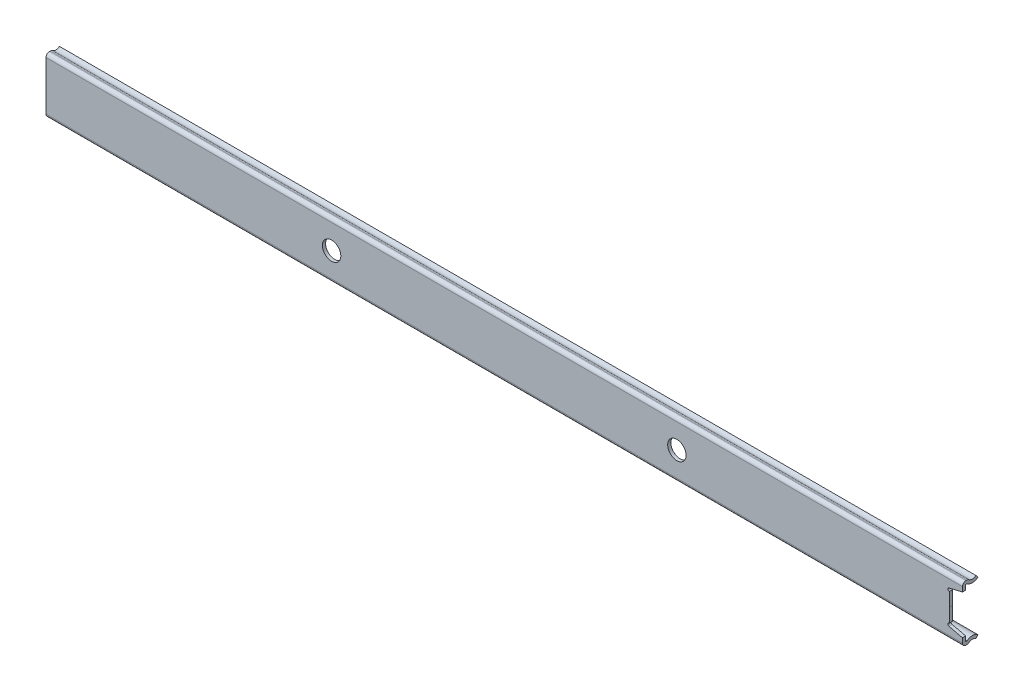
from build123d import *
from build123d.topology import SkipClean

# Parameters (mm, degrees)
EXTRUDE1_DEPTH        = 200.025
MIDDLE_MEMBER_DEPTH   = 400.05
DRAWER_START          = -400.05
DRAWER_MEMBER_DEPTH   = 400.05
SKETCH6_W             = 1.905
SKETCH6_H             = 12.147486483
CUT_EXTRUDE1_DEPTH    = 607.987132866
CUT_EXTRUDE2_DEPTH    = 1.1938
CUT_EXTRUDE3_DEPTH    = 1.397
CUT_EXTRUDE4_DEPTH    = 605.989768868
CUT_EXTRUDE5_DEPTH    = 1.1938
CUT_EXTRUDE14_DEPTH   = 1.1938
CUT_F_DEPTH           = 1.1938
CUT_G_DEPTH           = 1.1938
CUT_EXTRUDE15_DEPTH   = 1.1938
CUT_EXTRUDE17_DEPTH   = 1.2192
LPATTERN1_COUNT       = 6
LPATTERN1_PITCH       = 19.05
EXTRUDE7_DEPTH        = 6.35
EXTRUDE7_DEPTH_BACK   = 101.6
SKETCH28_W            = 7.62
SKETCH28_H            = 0.762
LPATTERN2_COUNT       = 6
LPATTERN2_PITCH       = 19.05
EXTRUDE8_DEPTH        = 6.35
EXTRUDE8_DEPTH_BACK   = 101.6
SKETCH30_W            = 5.08
SKETCH30_H            = 0.762
CROQUIS1_R            = 4
CORTAR_EXTRUIR1_DEPTH = 5


# Read off the part's stored shape, not the designer's step: Drawer Member
with BuildPart() as part:
    # Sketch1 → Extrude1 (new, symmetric)
    with BuildSketch(Plane(origin=(0, 0, 0), x_dir=(0, 0, -1), z_dir=(1, 0, 0))):
        with BuildLine():
            Line((-4.139279899, 22.8203125), (-0.743323143, 22.698920454))
            Line((-0.743323143, 22.698920454), (3.892452069, 22.8203125))
            ThreePointArc((3.892452069, 22.8203125), (5.124499805, 22.338098312), (5.6388, 21.119095664))
            Line((5.6388, 21.119095664), (5.6388, 0))
            Line((5.6388, 0), (4.445, 0))
            Line((4.445, 0), (4.445, 21.119095664))
            ThreePointArc((4.445, 21.119095664), (4.291477554, 21.482977052), (3.92370211, 21.626921585))
            Line((3.92370211, 21.626921585), (0.761857041, 21.544125758))
            ThreePointArc((0.761857041, 21.544125758), (-0.187154328, 21.71413397), (-1.131158407, 21.51822157))
            Line((-1.131158407, 21.51822157), (-4.181926298, 21.627274477))
            ThreePointArc((-4.181926298, 21.627274477), (-4.367367911, 21.55622161), (-4.445, 21.3734366))
            Line((-4.445, 21.3734366), (-4.445, 18.415))
            Line((-4.445, 18.415), (-5.6388, 18.415))
            Line((-5.6388, 18.415), (-5.6388, 21.3734366))
            ThreePointArc((-5.6388, 21.3734366), (-5.19629709, 22.415311161), (-4.139279899, 22.8203125))
        make_face()
    extrude(amount=EXTRUDE1_DEPTH, both=True)

    # Sketch8 → Cut-Extrude2 (cut)
    with BuildSketch(Plane.XY.offset(-4.445)):
        with BuildLine():
            Line((190.386533997, 7.645578895), (191.8208, 7.493000005))
            Line((191.8208, 7.493000005), (191.8208, 0))
            Line((191.8208, 0), (200.025, 0))
            Line((200.025, 0), (200.025, 12.204752384))
            Line((200.025, 12.204752384), (190.628356843, 12.204752384))
            ThreePointArc((190.628356843, 12.204752384), (188.345565723, 10.03983377), (190.386533997, 7.645578895))
        make_face()
    extrude(amount=-CUT_EXTRUDE2_DEPTH, mode=Mode.SUBTRACT)

    # Sketch13 → Cut-Extrude5 (cut)
    with BuildSketch(Plane.XY.offset(-4.445)):
        with BuildLine():
            Line((-131.636699917, 7.112000069), (-156.465199931, 7.112000069))
            ThreePointArc((-156.465199931, 7.112000069), (-157.004015347, 6.888815416), (-157.2272, 6.35))
            Line((-157.2272, 6.35), (-157.2272, 0))
            Line((-157.2272, 0), (-159.5132, 0))
            Line((-159.5132, 0), (-159.5132, 6.35))
            ThreePointArc((-159.5132, 6.35), (-159.736384653, 6.888815416), (-160.275200069, 7.112000069))
            Line((-160.275200069, 7.112000069), (-182.563699917, 7.112000069))
            ThreePointArc((-182.563699917, 7.112000069), (-184.151199917, 8.699500069), (-182.563699917, 10.287000069))
            Line((-182.563699917, 10.287000069), (-131.636699917, 10.287000069))
            ThreePointArc((-131.636699917, 10.287000069), (-130.049199917, 8.699500069), (-131.636699917, 7.112000069))
        make_face()
        with BuildLine():
            Line((-137.250099917, 2.286), (-142.203099917, 2.286))
            ThreePointArc((-142.203099917, 2.286), (-143.819546018, 1.616446102), (-144.489099917, 0))
            Line((-144.489099917, 0), (-134.964099917, 0))
            ThreePointArc((-134.964099917, 0), (-135.633653815, 1.616446102), (-137.250099917, 2.286))
        make_face()
        with BuildLine():
            Line((-176.302599917, 0), (-171.730599917, 0))
            ThreePointArc((-171.730599917, 0), (-174.016599917, 2.286), (-176.302599917, 0))
        make_face()
        with BuildLine():
            Line((-168.200000083, 0), (-161.849999917, 0))
            ThreePointArc((-161.849999917, 0), (-165.025, 3.175000083), (-168.200000083, 0))
        make_face()
        with BuildLine():
            Line((-154.712599917, 0), (-150.140599917, 0))
            ThreePointArc((-150.140599917, 0), (-152.426599917, 2.286), (-154.712599917, 0))
        make_face()
    extrude(amount=-CUT_EXTRUDE5_DEPTH, mode=Mode.SUBTRACT)

    # Sketch32 → Cut-Extrude14 (cut)
    with BuildSketch(Plane(origin=(0, 0, -5.6388), x_dir=(-1, 0, 0), z_dir=(0, 0, -1))):
        with BuildLine():
            Line((19.5625, 0), (29.0875, 0))
            ThreePointArc((29.0875, 0), (28.417946102, 1.616446102), (26.8015, 2.286))
            Line((26.8015, 2.286), (21.8485, 2.286))
            ThreePointArc((21.8485, 2.286), (20.232053898, 1.616446102), (19.5625, 0))
        make_face()
        with BuildLine():
            Line((33.85, 0), (40.2, 0))
            ThreePointArc((40.2, 0), (37.025, 3.175), (33.85, 0))
        make_face()
        with BuildLine():
            Line((43.6925, 0), (53.2175, 0))
            ThreePointArc((53.2175, 0), (52.547946102, 1.616446102), (50.9315, 2.286))
            Line((50.9315, 2.286), (45.9785, 2.286))
            ThreePointArc((45.9785, 2.286), (44.362053898, 1.616446102), (43.6925, 0))
        make_face()
        with BuildLine():
            Line((56.583, 0), (61.155, 0))
            Line((61.155, 0), (61.155, 8.763000069))
            ThreePointArc((61.155, 8.763000069), (60.708630735, 9.840630803), (59.631, 10.287000069))
            Line((59.631, 10.287000069), (16.3875, 10.287000069))
            ThreePointArc((16.3875, 10.287000069), (14.8, 8.699500069), (16.3875, 7.112000069))
            Line((16.3875, 7.112000069), (55.059, 7.112000069))
            ThreePointArc((55.059, 7.112000069), (56.136630735, 6.665630803), (56.583, 5.588000069))
            Line((56.583, 5.588000069), (56.583, 0))
        make_face()
    extrude(amount=-CUT_EXTRUDE14_DEPTH, mode=Mode.SUBTRACT)

    # Sketch33 → Cut F (cut)
    with BuildSketch(Plane(origin=(83.609365602, 0.812450965, -5.6388), x_dir=(-1, 0, 0), z_dir=(0, 0, -1))):
        with BuildLine():
            Line((21.459365602, -0.812450965), (27.809365602, -0.812450965))
            ThreePointArc((27.809365602, -0.812450965), (24.634365602, 2.362549035), (21.459365602, -0.812450965))
        make_face()
        with BuildLine():
            Line((31.301865602, -0.812450965), (40.826865602, -0.812450965))
            ThreePointArc((40.826865602, -0.812450965), (40.157311704, 0.803995136), (38.540865602, 1.473549035))
            Line((38.540865602, 1.473549035), (33.587865602, 1.473549035))
            ThreePointArc((33.587865602, 1.473549035), (31.9714195, 0.803995136), (31.301865602, -0.812450965))
        make_face()
        with BuildLine():
            Line((44.192365602, -0.812450965), (48.764365602, -0.812450965))
            Line((48.764365602, -0.812450965), (48.764365602, 7.950549103))
            ThreePointArc((48.764365602, 7.950549103), (48.317996337, 9.028179838), (47.240365602, 9.474549103))
            Line((47.240365602, 9.474549103), (3.996865602, 9.474549103))
            ThreePointArc((3.996865602, 9.474549103), (2.409365602, 7.887049103), (3.996865602, 6.299549103))
            Line((3.996865602, 6.299549103), (42.668365602, 6.299549103))
            ThreePointArc((42.668365602, 6.299549103), (43.745996337, 5.853179838), (44.192365602, 4.775549103))
            Line((44.192365602, 4.775549103), (44.192365602, -0.812450965))
        make_face()
        with BuildLine():
            Line((9.648365602, -0.812450965), (14.220365602, -0.812450965))
            ThreePointArc((14.220365602, -0.812450965), (11.934365602, 1.473549035), (9.648365602, -0.812450965))
        make_face()
    extrude(amount=-CUT_F_DEPTH, mode=Mode.SUBTRACT)

    # Sketch34 → Cut G (cut)
    with BuildSketch(Plane(origin=(169.823604257, 1.452669916, -5.6388), x_dir=(-1, 0, 0), z_dir=(0, 0, -1))):
        with BuildLine():
            Line((-2.653895743, -1.452669916), (6.871104257, -1.452669916))
            ThreePointArc((6.871104257, -1.452669916), (6.201550358, 0.163776186), (4.585104257, 0.833330084))
            Line((4.585104257, 0.833330084), (-0.367895743, 0.833330084))
            ThreePointArc((-0.367895743, 0.833330084), (-1.984341845, 0.163776186), (-2.653895743, -1.452669916))
        make_face()
        with BuildLine():
            Line((11.633604257, -1.452669916), (17.983604257, -1.452669916))
            ThreePointArc((17.983604257, -1.452669916), (14.808604257, 1.722330084), (11.633604257, -1.452669916))
        make_face()
        with BuildLine():
            Line((21.476104257, -1.452669916), (31.001104257, -1.452669916))
            ThreePointArc((31.001104257, -1.452669916), (30.331550358, 0.163776186), (28.715104257, 0.833330084))
            Line((28.715104257, 0.833330084), (23.762104257, 0.833330084))
            ThreePointArc((23.762104257, 0.833330084), (22.145658155, 0.163776186), (21.476104257, -1.452669916))
        make_face()
        with BuildLine():
            Line((34.366604257, -1.452669916), (38.938604257, -1.452669916))
            Line((38.938604257, -1.452669916), (38.938604257, 7.310330153))
            ThreePointArc((38.938604257, 7.310330153), (38.492234991, 8.387960887), (37.414604257, 8.834330153))
            Line((37.414604257, 8.834330153), (-5.828895743, 8.834330153))
            ThreePointArc((-5.828895743, 8.834330153), (-7.416395743, 7.246830153), (-5.828895743, 5.659330153))
            Line((-5.828895743, 5.659330153), (32.842604257, 5.659330153))
            ThreePointArc((32.842604257, 5.659330153), (33.920234991, 5.212960887), (34.366604257, 4.135330153))
            Line((34.366604257, 4.135330153), (34.366604257, -1.452669916))
        make_face()
    extrude(amount=-CUT_G_DEPTH, mode=Mode.SUBTRACT)

    # Sketch31 → Cut-Extrude15 (cut)
    with BuildSketch(Plane(origin=(0, 0, -5.6388), x_dir=(-1, 0, 0), z_dir=(0, 0, -1))):
        with BuildLine():
            Line((-184.15, 0), (-177.8, 0))
            ThreePointArc((-177.8, 0), (-180.975, 3.175), (-184.15, 0))
        make_face()
    extrude(amount=-CUT_EXTRUDE15_DEPTH, mode=Mode.SUBTRACT)

    # Mirror3 3: part across plane


with BuildPart() as body_2:
    # Sketch2 → Middle Member (new body)
    with BuildSketch(Plane.ZY.offset(403.225)):
        with BuildLine():
            ThreePointArc((5.7404, 15.627692517), (3.735864231, 17.127444277), (1.241474216, 16.914283663))
            ThreePointArc((1.241474216, 16.914283663), (-0.188944013, 16.688900955), (-1.505642365, 17.291560999))
            ThreePointArc((-1.505642365, 17.291560999), (-2.813430342, 17.487614783), (-3.53059999, 16.376572852))
            Line((-3.53059999, 16.376572852), (-3.53059999, 9.521737984))
            ThreePointArc((-3.53059999, 9.521737984), (-3.220327109, 8.457239952), (-2.386691239, 7.726160915))
            Line((-2.386691239, 7.726160915), (-0.414564934, 6.806543316))
            ThreePointArc((-0.414564934, 6.806543316), (-0.093935732, 6.525359052), (0.0254, 6.115936705))
            Line((0.0254, 6.115936705), (0.0254, 0))
            Line((0.0254, 0), (1.2446, 0))
            Line((1.2446, 0), (1.2446, 6.115936705))
            ThreePointArc((1.2446, 6.115936705), (0.934327119, 7.180434735), (0.100691251, 7.91151377))
            Line((0.100691251, 7.91151377), (-1.871435054, 8.831131369))
            ThreePointArc((-1.871435054, 8.831131369), (-2.192064258, 9.112315634), (-2.31139999, 9.521737984))
            Line((-2.31139999, 9.521737984), (-2.31139999, 16.376572852))
            ThreePointArc((-2.31139999, 16.376572852), (-2.311399987, 16.376572856), (-2.311399982, 16.376572855))
            ThreePointArc((-2.311399982, 16.376572855), (-0.35482671, 15.481038557), (1.770730805, 15.815950333))
            ThreePointArc((1.770730805, 15.815950333), (3.400639083, 15.955235789), (4.710462095, 14.975253591))
            Line((4.710462095, 14.975253591), (5.7404, 15.627692517))
        make_face()
    extrude(amount=-MIDDLE_MEMBER_DEPTH)

    # Sketch12 → Cut-Extrude4 (cut, through all)
    with BuildSketch(Plane.XY.offset(1.2446)):
        with BuildLine():
            Line((-3.175, 12.065), (-13.335, 12.065))
            ThreePointArc((-13.335, 12.065), (-15.131051224, 11.321051224), (-15.875, 9.525))
            Line((-15.875, 9.525), (-15.875, 0))
            Line((-15.875, 0), (-3.175, 0))
            Line((-3.175, 0), (-3.175, 12.065))
        make_face()
    extrude(amount=-CUT_EXTRUDE4_DEPTH, mode=Mode.SUBTRACT)

    # Sketch26 → Cut-Extrude17 (cut)
    with BuildSketch(Plane.XY.offset(1.2446)):
        with BuildLine():
            Line((-176.302599917, 0), (-134.964099917, 0))
            ThreePointArc((-134.964099917, 0), (-136.377602591, 3.412497326), (-139.790099917, 4.826))
            Line((-139.790099917, 4.826), (-171.476599917, 4.826))
            ThreePointArc((-171.476599917, 4.826), (-174.889097243, 3.412497326), (-176.302599917, 0))
        make_face()
        with BuildLine():
            Line((-19.5625, 0), (-53.2175, 0))
            ThreePointArc((-53.2175, 0), (-51.803997326, 3.412497326), (-48.3915, 4.826))
            Line((-48.3915, 4.826), (-24.3885, 4.826))
            ThreePointArc((-24.3885, 4.826), (-20.976002674, 3.412497326), (-19.5625, 0))
        make_face()
        with BuildLine():
            Line((76.4375, 0), (42.7825, 0))
            ThreePointArc((42.7825, 0), (44.196002674, 3.412497326), (47.6085, 4.826))
            Line((47.6085, 4.826), (71.6115, 4.826))
            ThreePointArc((71.6115, 4.826), (75.023997326, 3.412497326), (76.4375, 0))
        make_face()
    extrude(amount=-CUT_EXTRUDE17_DEPTH, mode=Mode.SUBTRACT)

    # Mirror3 2: body 2 across plane


with BuildPart() as body_3:
    # Drawer Member outline → Drawer Member (new body)
    with BuildSketch(Plane.ZY.offset(606.425).offset(DRAWER_START)):
        with BuildLine():
            Line((5.6642, 0), (7.0612, 0))
            Line((7.0612, 0), (7.0612, 10.623486483))
            ThreePointArc((7.0612, 10.623486483), (6.614830734, 11.701117218), (5.5372, 12.147486483))
            Line((5.5372, 12.147486483), (5.164341455, 12.147486483))
            ThreePointArc((5.164341455, 12.147486483), (4.67440708, 12.066587417), (4.236487447, 11.83247901))
            ThreePointArc((4.236487447, 11.83247901), (2.709144677, 11.334862777), (1.208194452, 11.907179363))
            Line((1.208194452, 11.907179363), (0.304054167, 10.842219578))
            ThreePointArc((0.304054167, 10.842219578), (2.674694689, 9.938287609), (5.087020295, 10.724235863))
            ThreePointArc((5.087020295, 10.724235863), (5.123513594, 10.743744895), (5.164341455, 10.750486483))
            Line((5.164341455, 10.750486483), (5.5372, 10.750486483))
            ThreePointArc((5.5372, 10.750486483), (5.627002561, 10.713289044), (5.6642, 10.623486483))
            Line((5.6642, 10.623486483), (5.6642, 0))
        make_face()
    extrude(amount=DRAWER_MEMBER_DEPTH)

    # Sketch6 → Cut-Extrude1 (cut, through all)
    with BuildSketch(Plane.XY.offset(7.0612)):
        with Locations((-605.4725, 6.073743242)):
            Rectangle(SKETCH6_W, SKETCH6_H)
    extrude(amount=-CUT_EXTRUDE1_DEPTH, mode=Mode.SUBTRACT)

    # Sketch11 → Cut-Extrude3 (cut)
    with BuildSketch(Plane.XY.offset(7.0612)):
        with BuildLine():
            Line((-212.089951398, 5.967847879), (-212.09, 0))
            Line((-212.09, 0), (-206.375, 0))
            Line((-206.375, 0), (-206.375, 8.589285844))
            Line((-206.375, 8.589285844), (-212.234326457, 7.221216084))
            ThreePointArc((-212.234326457, 7.221216084), (-212.720774848, 6.530182899), (-212.089951398, 5.967847879))
        make_face()
    extrude(amount=-CUT_EXTRUDE3_DEPTH, mode=Mode.SUBTRACT)

    # Mirror3: body 3 across plane


with BuildPart() as body_4:
    # Sketch27 → Revolve1 (revolve)
    with BuildSketch(Plane.ZY.offset(187.325)):
        with BuildLine():
            Line((0.1524, 21.683172421), (0.1524, 16.665571078))
            ThreePointArc((0.1524, 16.665571078), (2.661200671, 19.174371749), (0.1524, 21.683172421))
        make_face()
    revolve(axis=Axis((-187.325, 23.635004298, 0.1524), (0, -1, 0)))


with BuildPart() as lpattern1_1:
    # LPattern1: pattern copy
    add(body_4.part.moved(Location(Vector(1, 0, 0) * (1 * LPATTERN1_PITCH))))


with BuildPart() as lpattern1_2:
    # LPattern1: pattern copy
    add(body_4.part.moved(Location(Vector(1, 0, 0) * (2 * LPATTERN1_PITCH))))


with BuildPart() as lpattern1_3:
    # LPattern1: pattern copy
    add(body_4.part.moved(Location(Vector(1, 0, 0) * (3 * LPATTERN1_PITCH))))


with BuildPart() as lpattern1_4:
    # LPattern1: pattern copy
    add(body_4.part.moved(Location(Vector(1, 0, 0) * (4 * LPATTERN1_PITCH))))


with BuildPart() as lpattern1_5:
    # LPattern1: pattern copy
    add(body_4.part.moved(Location(Vector(1, 0, 0) * (5 * LPATTERN1_PITCH))))


with BuildPart() as body_4_1:
    add(body_4.part)

    add(lpattern1_1.part)  # Extrude7 merges LPattern1_1

    add(lpattern1_2.part)  # Extrude7 merges LPattern1_2

    add(lpattern1_3.part)  # Extrude7 merges LPattern1_3

    add(lpattern1_4.part)  # Extrude7 merges LPattern1_4

    add(lpattern1_5.part)  # Extrude7 merges LPattern1_5
    # Sketch28 → Extrude7 (add, two sides: drawn at the far end of the back side and taken through both)
    with BuildSketch(Plane.ZY.offset(187.325).offset(-EXTRUDE7_DEPTH_BACK)):
        with Locations((0.1524, 19.174371749)):
            Rectangle(SKETCH28_W, SKETCH28_H)
    extrude(amount=EXTRUDE7_DEPTH + EXTRUDE7_DEPTH_BACK)


with BuildPart() as body_5:
    # Sketch29 → Revolve2 (revolve)
    with BuildSketch(Plane.ZY.offset(365.125)):
        with BuildLine():
            Line((2.7686, 16.043834368), (2.7686, 11.446434358))
            ThreePointArc((2.7686, 11.446434358), (5.067300005, 13.745134363), (2.7686, 16.043834368))
        make_face()
    revolve(axis=Axis((-365.125, 16.680143034, 2.7686), (0, -1, 0)))


with BuildPart() as lpattern2_1:
    # LPattern2: pattern copy
    add(body_5.part.moved(Location(Vector(1, 0, 0) * (1 * LPATTERN2_PITCH))))


with BuildPart() as lpattern2_2:
    # LPattern2: pattern copy
    add(body_5.part.moved(Location(Vector(1, 0, 0) * (2 * LPATTERN2_PITCH))))


with BuildPart() as lpattern2_3:
    # LPattern2: pattern copy
    add(body_5.part.moved(Location(Vector(1, 0, 0) * (3 * LPATTERN2_PITCH))))


with BuildPart() as lpattern2_4:
    # LPattern2: pattern copy
    add(body_5.part.moved(Location(Vector(1, 0, 0) * (4 * LPATTERN2_PITCH))))


with BuildPart() as lpattern2_5:
    # LPattern2: pattern copy
    add(body_5.part.moved(Location(Vector(1, 0, 0) * (5 * LPATTERN2_PITCH))))


with BuildPart() as body_5_1:
    add(body_5.part)

    add(lpattern2_1.part)  # Extrude8 merges LPattern2_1

    add(lpattern2_2.part)  # Extrude8 merges LPattern2_2

    add(lpattern2_3.part)  # Extrude8 merges LPattern2_3

    add(lpattern2_4.part)  # Extrude8 merges LPattern2_4

    add(lpattern2_5.part)  # Extrude8 merges LPattern2_5
    # Sketch30 → Extrude8 (add, two sides: drawn at the far end of the back side and taken through both)
    with BuildSketch(Plane.ZY.offset(365.125).offset(-EXTRUDE8_DEPTH_BACK)):
        with Locations((2.7686, 13.745134363)):
            Rectangle(SKETCH30_W, SKETCH30_H)
    extrude(amount=EXTRUDE8_DEPTH + EXTRUDE8_DEPTH_BACK)


with BuildPart() as body_3_1:
    add(body_3.part)
    add(body_3.part.mirror(Plane.ZX))

    # Croquis1 → Cortar-Extruir1 (cut)
    with BuildSketch(Plane.XY.offset(7.0612)):
        with Locations((-330.4475, 0)):
            Circle(CROQUIS1_R)
        with Locations((-480.4475, 0)):
            Circle(CROQUIS1_R)
    extrude(amount=-CORTAR_EXTRUIR1_DEPTH, mode=Mode.SUBTRACT)


with BuildPart() as body_2_1:
    add(body_2.part)
    add(body_2.part.mirror(Plane.ZX))


with BuildPart() as part_1:
    with SkipClean():  # the faces are left unmerged after this step: merging them gives an invalid solid
        add(part.part)
        add(part.part.mirror(Plane.ZX))


with BuildPart() as body_6:
    # Mirror5: mirrored copy
    add(body_5_1.part.mirror(Plane.ZX))


with BuildPart() as body_7:
    # Mirror5 2: mirrored copy
    add(body_4_1.part.mirror(Plane.ZX))


solid = body_3_1.part
